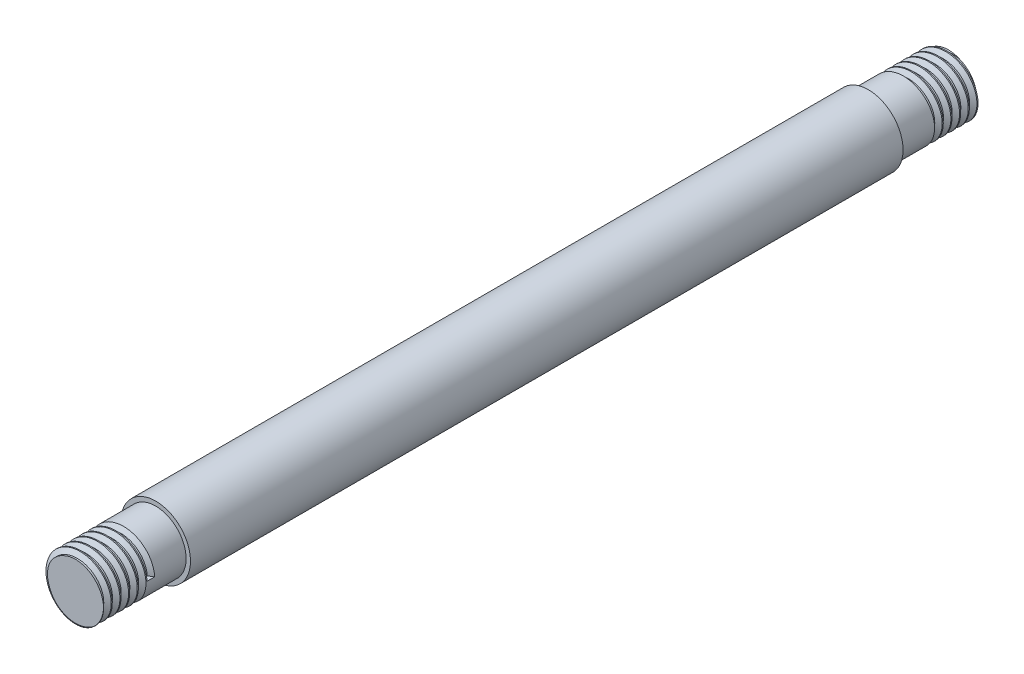
from build123d import *

# Parameters (mm, degrees)
THREAD1_PITCH = 2
THREAD2_PITCH = 2


with BuildPart() as part:
    # Sketch1 → Revolve8 (revolve)
    with BuildSketch(Plane(origin=(0, 0, 0), x_dir=(0, 0, -1), z_dir=(1, 0, 0)), mode=Mode.PRIVATE) as revolve8_sk:
        Polygon((-69.022947086, 0), (132.977052914, 0), (132.977052914, -7), (113.977052914, -7), (113.977052914, -8), (-50.022947086, -8), (-50.022947086, -7), (-69.022947086, -7), align=None)
    revolve(revolve8_sk.sketch.rotate(Axis((0, 0, 69.022947086), (0, 0, -1)), 270), axis=Axis((0, 0, 69.022947086), (0, 0, -1)))

    # Thread1: arcs per turn and ends read off the stored shape
    # Thread1: the profile of Thread Profile1 profile screwed along a right-hand helix through 6.5 turns, 10 arcs to a turn; built about Z, then put on its axis
    thread1_z = Axis((0, 0, 0), (0, 0, 1))
    thread1_corners = [(7.0003, 0, -0.000173205), (7.0003, 0, 1.7501732), (5.91746825, 0, 1.124999997), (5.91746825, 0, 0.624999997)]
    with BuildLine(mode=Mode.PRIVATE) as thread1_profile:
        Line(thread1_corners[0], thread1_corners[1])
        Line(thread1_corners[1], thread1_corners[2])
        Line(thread1_corners[2], thread1_corners[3])
        Line(thread1_corners[3], thread1_corners[0])
    thread1_cap = Face(thread1_profile.wire())
    thread1_turn_angles = [0, 18, 36, 54, 72, 90, 108, 126, 144, 162, 180, 198, 216, 234, 252, 270, 288, 306, 324, 342, 360]
    thread1_turn_weights = [1, 0.9510565162951535, 1, 0.9510565162951535, 1, 0.9510565162951535, 1, 0.9510565162951535, 1, 0.9510565162951535, 1, 0.9510565162951535, 1, 0.9510565162951535, 1, 0.9510565162951535, 1, 0.9510565162951535, 1, 0.9510565162951535, 1]
    thread1_turn_rails = [Edge.make_bspline([Vector(p[0], p[1], 0).rotate(thread1_z, thread1_turn_angles[k]) / thread1_turn_weights[k] + Vector(0, 0, p[2] + THREAD1_PITCH * thread1_turn_angles[k] / 360) for k in range(21)], [0, 0, 0, 1, 1, 2, 2, 3, 3, 4, 4, 5, 5, 6, 6, 7, 7, 8, 8, 9, 9, 10, 10, 10], 2, thread1_turn_weights) for p in thread1_corners]
    thread1_turn_sides = [Face.make_surface_from_curves(thread1_turn_rails[p[0]], thread1_turn_rails[p[1]]) for p in [(0, 1), (1, 2), (2, 3), (3, 0)]]
    thread1_last_angles = [2160, 2178, 2196, 2214, 2232, 2250, 2268, 2286, 2304, 2322, 2340]
    thread1_last_weights = [1, 0.9510565162951535, 1, 0.9510565162951535, 1, 0.9510565162951535, 1, 0.9510565162951535, 1, 0.9510565162951535, 1]
    thread1_last_rails = [Edge.make_bspline([Vector(p[0], p[1], 0).rotate(thread1_z, thread1_last_angles[k]) / thread1_last_weights[k] + Vector(0, 0, p[2] + THREAD1_PITCH * thread1_last_angles[k] / 360) for k in range(11)], [0, 0, 0, 1, 1, 2, 2, 3, 3, 4, 4, 5, 5, 5], 2, thread1_last_weights) for p in thread1_corners]
    thread1_last_sides = [Face.make_surface_from_curves(thread1_last_rails[p[0]], thread1_last_rails[p[1]]) for p in [(0, 1), (1, 2), (2, 3), (3, 0)]]
    thread1 = Plane(origin=(0, 0, 72.022947086), x_dir=(-1, 0, 0), z_dir=(0, 0, -1)) * Solid(Shell([*[p.moved(Location((0, 0, THREAD1_PITCH * i))) for i in range(6) for p in thread1_turn_sides], *thread1_last_sides, thread1_cap, thread1_cap.rotate(thread1_z, 2340).moved(Location((0, 0, THREAD1_PITCH * 2340 / 360)))]))
    add(thread1, mode=Mode.SUBTRACT)

    # Thread2: arcs per turn and ends read off the stored shape
    # Thread2: the profile of Thread Profile2 profile screwed along a right-hand helix through 6.5 turns, 10 arcs to a turn; built about Z, then put on its axis
    thread2_z = Axis((0, 0, 0), (0, 0, 1))
    thread2_corners = [(7.0003, 0, -0.000173205), (7.0003, 0, 1.7501732), (5.91746825, 0, 1.124999997), (5.91746825, 0, 0.624999997)]
    with BuildLine(mode=Mode.PRIVATE) as thread2_profile:
        Line(thread2_corners[0], thread2_corners[1])
        Line(thread2_corners[1], thread2_corners[2])
        Line(thread2_corners[2], thread2_corners[3])
        Line(thread2_corners[3], thread2_corners[0])
    thread2_cap = Face(thread2_profile.wire())
    thread2_turn_angles = [0, 18, 36, 54, 72, 90, 108, 126, 144, 162, 180, 198, 216, 234, 252, 270, 288, 306, 324, 342, 360]
    thread2_turn_weights = [1, 0.9510565162951535, 1, 0.9510565162951535, 1, 0.9510565162951535, 1, 0.9510565162951535, 1, 0.9510565162951535, 1, 0.9510565162951535, 1, 0.9510565162951535, 1, 0.9510565162951535, 1, 0.9510565162951535, 1, 0.9510565162951535, 1]
    thread2_turn_rails = [Edge.make_bspline([Vector(p[0], p[1], 0).rotate(thread2_z, thread2_turn_angles[k]) / thread2_turn_weights[k] + Vector(0, 0, p[2] + THREAD2_PITCH * thread2_turn_angles[k] / 360) for k in range(21)], [0, 0, 0, 1, 1, 2, 2, 3, 3, 4, 4, 5, 5, 6, 6, 7, 7, 8, 8, 9, 9, 10, 10, 10], 2, thread2_turn_weights) for p in thread2_corners]
    thread2_turn_sides = [Face.make_surface_from_curves(thread2_turn_rails[p[0]], thread2_turn_rails[p[1]]) for p in [(0, 1), (1, 2), (2, 3), (3, 0)]]
    thread2_last_angles = [2160, 2178, 2196, 2214, 2232, 2250, 2268, 2286, 2304, 2322, 2340]
    thread2_last_weights = [1, 0.9510565162951535, 1, 0.9510565162951535, 1, 0.9510565162951535, 1, 0.9510565162951535, 1, 0.9510565162951535, 1]
    thread2_last_rails = [Edge.make_bspline([Vector(p[0], p[1], 0).rotate(thread2_z, thread2_last_angles[k]) / thread2_last_weights[k] + Vector(0, 0, p[2] + THREAD2_PITCH * thread2_last_angles[k] / 360) for k in range(11)], [0, 0, 0, 1, 1, 2, 2, 3, 3, 4, 4, 5, 5, 5], 2, thread2_last_weights) for p in thread2_corners]
    thread2_last_sides = [Face.make_surface_from_curves(thread2_last_rails[p[0]], thread2_last_rails[p[1]]) for p in [(0, 1), (1, 2), (2, 3), (3, 0)]]
    thread2 = Plane(origin=(0, 0, -135.977052914), x_dir=(1, 0, 0), z_dir=(0, 0, 1)) * Solid(Shell([*[p.moved(Location((0, 0, THREAD2_PITCH * i))) for i in range(6) for p in thread2_turn_sides], *thread2_last_sides, thread2_cap, thread2_cap.rotate(thread2_z, 2340).moved(Location((0, 0, THREAD2_PITCH * 2340 / 360)))]))
    add(thread2, mode=Mode.SUBTRACT)


solid = part.part
